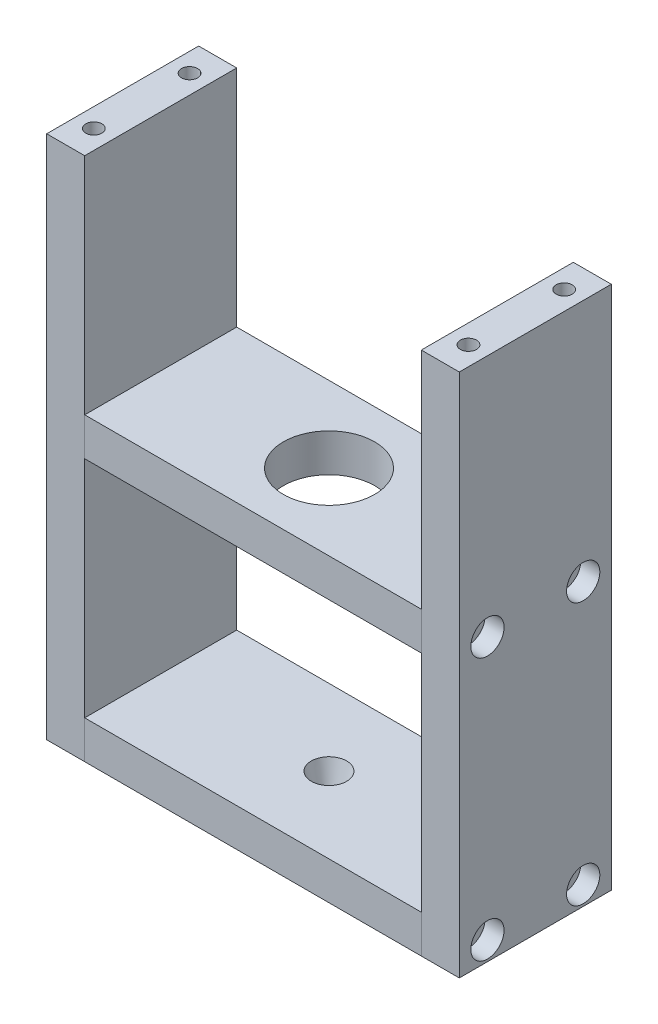
from build123d import *

# Parameters (mm, degrees)
CROQUIS13_W                                 = 50.8
CROQUIS13_H                                 = 12.7
SOLID_2_X_0_5_2_DEPTH                       = 175.4
CROQUIS13_ON_SEGMENT_2_W                    = 50.8
CROQUIS13_ON_SEGMENT_2_H                    = 12.7
SOLID_2_X_0_5_2_2_DEPTH                     = 175.4
CROQUIS13_ON_SEGMENT_3_W                    = 50.8
CROQUIS13_ON_SEGMENT_3_H                    = 12.7
SOLID_2_X_0_5_2_3_DEPTH                     = 127.2
CROQUIS13_ON_SEGMENT_4_W                    = 50.8
CROQUIS13_ON_SEGMENT_4_H                    = 12.7
SOLID_2_X_0_5_2_4_DEPTH                     = 127.2
REFRENTADO_PARA_TORNILLO_CON_CABEZA_2_COUNT = 2
REFRENTADO_PARA_TORNILLO_CON_CABEZA_2_PITCH = 87.7
REFRENTADO_PARA_TORNILLO_CON_CABEZA_3_COUNT = 2
REFRENTADO_PARA_TORNILLO_CON_CABEZA_3_PITCH = 93.355717554
REFRENTADO_PARA_TORNILLO_CON_CABEZA_4_COUNT = 2
REFRENTADO_PARA_TORNILLO_CON_CABEZA_4_PITCH = 32
SIMETR_A1_START                             = 62.6
SIMETR_A1_OUTLINE_R                         = 5.55625
SIMETR_A1_DEPTH                             = 6.35
SIMETR_A1_START_2                           = 56.25
SIMETR_A1_2_OUTLINE_R                       = 3.3782
SIMETR_A1_2_DEPTH                           = 6.35
CROQUIS19_R                                 = 15.25
CORTAR_EXTRUIR1_DEPTH                       = 12.7
CROQUIS20_R                                 = 2.5
CORTAR_EXTRUIR2_DEPTH                       = 12.7
CORTAR_EXTRUIR2_DRAFT                       = 15


# Read off the part's stored shape, not the designer's step: Simetría1
with BuildPart() as part:
    # Croquis13 → Solid 2 X 0.5(2) (new body)
    with BuildSketch(Plane(origin=(62.6, -12.7, 0), x_dir=(0, 0, 1), z_dir=(0, 1, 0))):
        Rectangle(CROQUIS13_W, CROQUIS13_H)
    extrude(amount=SOLID_2_X_0_5_2_DEPTH)

    # Simetría1 outline → Simetría1 (cut)
    with BuildSketch(Plane.YZ.offset(SIMETR_A1_START)):
        with Locations((-6.35, -16)):
            Circle(SIMETR_A1_OUTLINE_R)
        with Locations((81.35, -16)):
            Circle(SIMETR_A1_OUTLINE_R)
        with Locations((81.35, 16)):
            Circle(SIMETR_A1_OUTLINE_R)
        with Locations((-6.35, 16)):
            Circle(SIMETR_A1_OUTLINE_R)
    extrude(amount=SIMETR_A1_DEPTH, mode=Mode.SUBTRACT)

    # Simetr_a1 2 outline → Simetr_a1 2 (cut)
    with BuildSketch(Plane.YZ.offset(SIMETR_A1_START_2)):
        with Locations((-6.35, -16)):
            Circle(SIMETR_A1_2_OUTLINE_R)
        with Locations((81.35, -16)):
            Circle(SIMETR_A1_2_OUTLINE_R)
        with Locations((81.35, 16)):
            Circle(SIMETR_A1_2_OUTLINE_R)
        with Locations((-6.35, 16)):
            Circle(SIMETR_A1_2_OUTLINE_R)
    extrude(amount=SIMETR_A1_2_DEPTH, mode=Mode.SUBTRACT)

    # Simetr_a1 7 outline → Simetr_a1 7 (revolve, cut)
    with BuildSketch(Plane(origin=(62.6, 0, 16), x_dir=(1, 0, 0), z_dir=(0, 0, 1))):
        Polygon((0, 162.7), (0, 143.844611939), (2.7051, 145.47), (2.7051, 162.7), align=None)
    revolve(axis=Axis((62.6, 0, 16), (0, 1, 0)), mode=Mode.SUBTRACT)

    # Simetr_a1 8 outline → Simetr_a1 8 (revolve, cut)
    with BuildSketch(Plane(origin=(62.6, 0, -16), x_dir=(1, 0, 0), z_dir=(0, 0, 1))):
        Polygon((0, 162.7), (0, 143.844611939), (2.7051, 145.47), (2.7051, 162.7), align=None)
    revolve(axis=Axis((62.6, 0, -16), (0, 1, 0)), mode=Mode.SUBTRACT)


with BuildPart() as body_2:
    # Croquis13 on segment 2 (carried to segment 2) → Solid 2 X 0.5_2 2 (new body)
    with BuildSketch(Plane(origin=(-62.6, -12.7, 0), x_dir=(0, 0, 1), z_dir=(0, 1, 0))):
        Rectangle(CROQUIS13_ON_SEGMENT_2_W, CROQUIS13_ON_SEGMENT_2_H)
    extrude(amount=SOLID_2_X_0_5_2_2_DEPTH)

    # Croquis15 → Refrentado para tornillo con cabeza hueca de 1/41 (revolve, cut)
    with BuildSketch(Plane(origin=(-68.95, -6.35, 16), x_dir=(0, 0, 1), z_dir=(0, 1, 0))):
        Polygon((0, 0), (0, 137.9), (3.3782, 137.9), (3.3782, 6.35), (5.55625, 6.35), (5.55625, 0), align=None)
    refrentado_para_tornillo_con_cabeza_huec = revolve(axis=Axis((-75.3, -6.35, 16), (1, 0, 0)), mode=Mode.SUBTRACT)

    # Refrentado para tornillo con cabeza  2: Refrentado para tornillo con cabeza hueca de 1/41 ×2
    with Locations(*[(0, i * REFRENTADO_PARA_TORNILLO_CON_CABEZA_2_PITCH, 0) for i in range(1, REFRENTADO_PARA_TORNILLO_CON_CABEZA_2_COUNT)]):
        add(refrentado_para_tornillo_con_cabeza_huec, mode=Mode.SUBTRACT)

    # Refrentado para tornillo con cabeza  3: Refrentado para tornillo con cabeza hueca de 1/41 ×2
    with Locations(*[Vector(-1.1702116215866835e-15, 0.9394175557526336, -0.3427749348242189) * (i * REFRENTADO_PARA_TORNILLO_CON_CABEZA_3_PITCH) for i in range(1, REFRENTADO_PARA_TORNILLO_CON_CABEZA_3_COUNT)]):
        add(refrentado_para_tornillo_con_cabeza_huec, mode=Mode.SUBTRACT)

    # Refrentado para tornillo con cabeza  4: Refrentado para tornillo con cabeza hueca de 1/41 ×2
    with Locations(*[(0, 0, -i * REFRENTADO_PARA_TORNILLO_CON_CABEZA_4_PITCH) for i in range(1, REFRENTADO_PARA_TORNILLO_CON_CABEZA_4_COUNT)]):
        add(refrentado_para_tornillo_con_cabeza_huec, mode=Mode.SUBTRACT)

    # Croquis18 at point 3 (carried to point 3, square into its face) → Taladro roscado 1/4-282 at 3 (revolve, cut)
    with BuildSketch(Plane(origin=(-62.6, 162.7, 16), x_dir=(0, 0, 1), z_dir=(1, 0, 0))):
        Polygon((0, 0), (0, 18.855388061), (2.7051, 17.23), (2.7051, 0), align=None)
    revolve(axis=Axis((-62.6, 169.05, 16), (0, -1, 0)), mode=Mode.SUBTRACT)

    # Croquis18 at point 6 (carried to point 6, square into its face) → Taladro roscado 1/4-282 at 6 (revolve, cut)
    with BuildSketch(Plane(origin=(-62.6, 162.7, -16), x_dir=(0, 0, 1), z_dir=(1, 0, 0))):
        Polygon((0, 0), (0, 18.855388061), (2.7051, 17.23), (2.7051, 0), align=None)
    revolve(axis=Axis((-62.6, 169.05, -16), (0, -1, 0)), mode=Mode.SUBTRACT)


with BuildPart() as body_3:
    # Croquis13 on segment 3 (carried to segment 3) → Solid 2 X 0.5_2 3 (new body)
    with BuildSketch(Plane(origin=(-63.6, 81.35, 0), x_dir=(0, 0, 1), z_dir=(1, 0, 0))):
        Rectangle(CROQUIS13_ON_SEGMENT_3_W, CROQUIS13_ON_SEGMENT_3_H)
    extrude(amount=SOLID_2_X_0_5_2_3_DEPTH)

    # Solid 2 X 0.5_2 3 end butt 1
    split(bisect_by=Plane(origin=(-56.25, 81.35, 0), x_dir=(0, 1, 0), z_dir=(1, 0, 0)), keep=Keep.TOP)

    # Solid 2 X 0.5_2 3 end butt 2
    split(bisect_by=Plane(origin=(56.25, 81.35, 0), x_dir=(0, -1, 0), z_dir=(-1, 0, 0)), keep=Keep.TOP)

    # Croquis18 at point 2 (carried to point 2, square into its face) → Taladro roscado 1/4-282 at 2 (revolve, cut)
    with BuildSketch(Plane(origin=(-56.25, 81.35, 16), x_dir=(0, 0, 1), z_dir=(0, 1, 0))):
        Polygon((0, 0), (0, 18.855388061), (2.7051, 17.23), (2.7051, 0), align=None)
    revolve(axis=Axis((-62.6, 81.35, 16), (1, 0, 0)), mode=Mode.SUBTRACT)

    # Croquis18 at point 5 (carried to point 5, square into its face) → Taladro roscado 1/4-282 at 5 (revolve, cut)
    with BuildSketch(Plane(origin=(-56.25, 81.35, -16), x_dir=(0, 0, 1), z_dir=(0, 1, 0))):
        Polygon((0, 0), (0, 18.855388061), (2.7051, 17.23), (2.7051, 0), align=None)
    revolve(axis=Axis((-62.6, 81.35, -16), (1, 0, 0)), mode=Mode.SUBTRACT)

    # Simetr_a1 3 outline → Simetr_a1 3 (revolve, cut)
    with BuildSketch(Plane(origin=(0, 81.35, -16), x_dir=(0, 1, 0), z_dir=(0, 0, -1))):
        Polygon((0, 37.394611939), (2.7051, 39.02), (2.7051, 56.25), (0, 56.25), align=None)
    revolve(axis=Axis((0, 81.35, -16), (1, 0, 0)), mode=Mode.SUBTRACT)

    # Simetr_a1 4 outline → Simetr_a1 4 (revolve, cut)
    with BuildSketch(Plane(origin=(0, 81.35, 16), x_dir=(0, 1, 0), z_dir=(0, 0, -1))):
        Polygon((0, 37.394611939), (2.7051, 39.02), (2.7051, 56.25), (0, 56.25), align=None)
    revolve(axis=Axis((0, 81.35, 16), (1, 0, 0)), mode=Mode.SUBTRACT)

    # Croquis19 → Cortar-Extruir1 (cut)
    with BuildSketch(Plane.XZ.offset(-75)):
        with Locations(Location((0, 0, 0), (0, 0, 270))):
            Circle(CROQUIS19_R)
    extrude(amount=-CORTAR_EXTRUIR1_DEPTH, mode=Mode.SUBTRACT)


with BuildPart() as body_4:
    # Croquis13 on segment 4 (carried to segment 4) → Solid 2 X 0.5_2 4 (new body)
    with BuildSketch(Plane(origin=(63.6, -6.35, 0), x_dir=(0, 0, 1), z_dir=(-1, 0, 0))):
        Rectangle(CROQUIS13_ON_SEGMENT_4_W, CROQUIS13_ON_SEGMENT_4_H)
    extrude(amount=SOLID_2_X_0_5_2_4_DEPTH)

    # Solid 2 X 0.5_2 4 end butt 1
    split(bisect_by=Plane(origin=(56.25, -6.35, 0), x_dir=(0, -1, 0), z_dir=(-1, 0, 0)), keep=Keep.TOP)

    # Solid 2 X 0.5_2 4 end butt 2
    split(bisect_by=Plane(origin=(-56.25, -6.35, 0), x_dir=(0, 1, 0), z_dir=(1, 0, 0)), keep=Keep.TOP)

    # Croquis18 → Taladro roscado 1/4-282 (revolve, cut)
    with BuildSketch(Plane(origin=(-56.25, -6.35, 16), x_dir=(0, 0, 1), z_dir=(0, 1, 0))):
        Polygon((0, 0), (0, 18.855388061), (2.7051, 17.23), (2.7051, 0), align=None)
    revolve(axis=Axis((-62.6, -6.35, 16), (1, 0, 0)), mode=Mode.SUBTRACT)

    # Croquis18 at point 4 (carried to point 4, square into its face) → Taladro roscado 1/4-282 at 4 (revolve, cut)
    with BuildSketch(Plane(origin=(-56.25, -6.35, -16), x_dir=(0, 0, 1), z_dir=(0, 1, 0))):
        Polygon((0, 0), (0, 18.855388061), (2.7051, 17.23), (2.7051, 0), align=None)
    revolve(axis=Axis((-62.6, -6.35, -16), (1, 0, 0)), mode=Mode.SUBTRACT)

    # Simetr_a1 5 outline → Simetr_a1 5 (revolve, cut)
    with BuildSketch(Plane(origin=(0, -6.35, -16), x_dir=(0, 1, 0), z_dir=(0, 0, -1))):
        Polygon((0, 37.394611939), (2.7051, 39.02), (2.7051, 56.25), (0, 56.25), align=None)
    revolve(axis=Axis((0, -6.35, -16), (1, 0, 0)), mode=Mode.SUBTRACT)

    # Simetr_a1 6 outline → Simetr_a1 6 (revolve, cut)
    with BuildSketch(Plane(origin=(0, -6.35, 16), x_dir=(0, 1, 0), z_dir=(0, 0, -1))):
        Polygon((0, 37.394611939), (2.7051, 39.02), (2.7051, 56.25), (0, 56.25), align=None)
    revolve(axis=Axis((0, -6.35, 16), (1, 0, 0)), mode=Mode.SUBTRACT)


with BuildPart() as cortar_extruir2_tool:
    # Croquis20 → Cortar-Extruir2 (with draft: the straight prism first)
    with BuildSketch(Plane.XZ.offset(12.7)):
        Circle(CROQUIS20_R)
    extrude(amount=-CORTAR_EXTRUIR2_DEPTH)
    # Cortar-Extruir2: the draft: its side faces are tilted about the plane it starts from
    cortar_extruir2_sides = [cortar_extruir2_tool.faces().sort_by_distance(p)[0] for p in [
        (-2.5, -6.35, 0),
    ]]
    draft(cortar_extruir2_sides, Plane.XZ.offset(12.7), CORTAR_EXTRUIR2_DRAFT)


with BuildPart() as body_4_1:
    add(body_4.part)

    # Cortar-Extruir2: cut by cortar_extruir2_tool
    add(cortar_extruir2_tool.part, mode=Mode.SUBTRACT)


solid = Compound([part.part, body_2.part, body_3.part, body_4_1.part])
